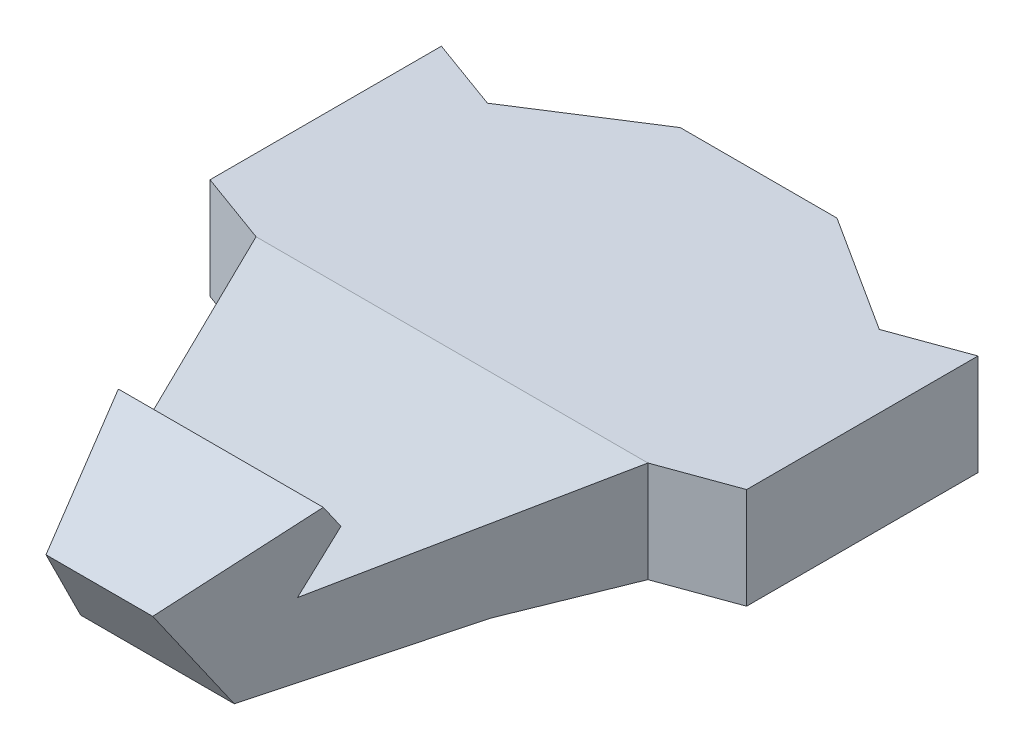
from build123d import *

# Parameters (mm, degrees)
BOSS_EXTRU_1_DEPTH           = 350
ENL_V_MAT_EXTRU_2_DEPTH      = 656.667598711
ENL_V_MAT_EXTRU_2_DEPTH_BACK = 350
ESQUISSE2_W                  = 784.427743825
ESQUISSE2_H                  = 526.453738787


with BuildPart() as part:
    # Esquisse1 → Boss.-Extru.1 (new body)
    with BuildSketch(Plane(origin=(0, 0, 0), x_dir=(1, 0, 0), z_dir=(0, 1, 0))):
        Polygon((226.103190441, 430), (123.896809559, 430), (47.210181475, 380.911501279), (0, 398.09460209), (0, 247.183100811), (47.210181475, 230), (140.193619195, 0), (209.806380805, 0), (302.789818525, 230), (350, 247.183100811), (350, 398.09460209), (302.789818525, 380.911501279), align=None)
    extrude(amount=BOSS_EXTRU_1_DEPTH)

    # Esquisse2 → Enlèv. mat.-Extru.2 (cut, two sides: drawn at the far end of the back side and taken through both)
    with BuildSketch(Plane(origin=(0, 0, 0), x_dir=(0, 0, -1), z_dir=(1, 0, 0)).offset(-ENL_V_MAT_EXTRU_2_DEPTH_BACK)):
        with Locations((249.397567388, 164.460448584)):
            Rectangle(ESQUISSE2_W, ESQUISSE2_H)
        Polygon((157.44106444, 12.933139467), (37.891584418, 0), (0, 60.70391631), (79.216518503, 98.684774091), (87.420569901, 85.541537747), (67.242094334, 51.299276179), (230, 78.834698818), (430, 78.834698818), (430, 12.933139467), (230, 12.933139467), align=None, mode=Mode.SUBTRACT)
    extrude(amount=ENL_V_MAT_EXTRU_2_DEPTH + ENL_V_MAT_EXTRU_2_DEPTH_BACK, mode=Mode.SUBTRACT)


solid = part.part
